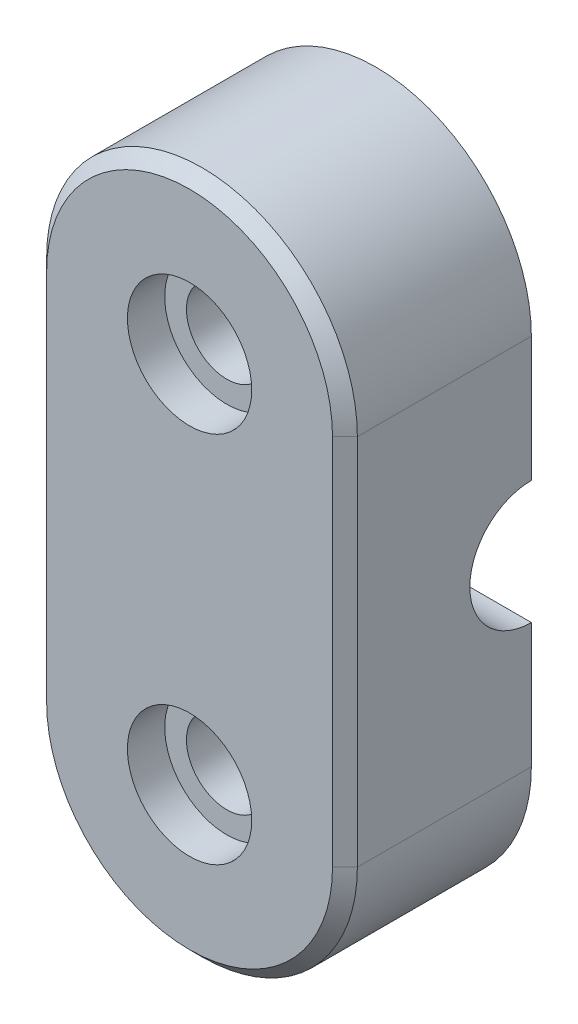
from build123d import *

# Parameters (mm, degrees)
SKETCH1_R           = 3.25
BOSS_EXTRUDE1_DEPTH = 15
CUT_EXTRUDE1_REACH  = 42.078
SKETCH2_R           = 4.95
CHAMFER1_SIZE       = 1
SKETCH3_R           = 5
CUT_EXTRUDE2_DEPTH  = 3


with BuildPart() as part:
    # Sketch1 → Boss-Extrude1 (new body)
    with BuildSketch(Plane.XY):
        with BuildLine():
            Line((-12.5, 15), (-12.5, -15))
            ThreePointArc((-12.5, -15), (0, -27.5), (12.5, -15))
            Line((12.5, -15), (12.5, 15))
            ThreePointArc((12.5, 15), (0, 27.5), (-12.5, 15))
        make_face()
        with Locations((0, 15)):
            Circle(SKETCH1_R, mode=Mode.SUBTRACT)
        with Locations((0, -15)):
            Circle(SKETCH1_R, mode=Mode.SUBTRACT)
    extrude(amount=BOSS_EXTRUDE1_DEPTH)

    # Sketch2 → Cut-Extrude1 (cut, up to next)
    with BuildSketch(Plane(origin=(12.5, 0, 0), x_dir=(0, 0, -1), z_dir=(1, 0, 0)), mode=Mode.PRIVATE) as cut_extrude1_sk1:
        Circle(SKETCH2_R)
    cut_extrude1_tool1 = extrude(cut_extrude1_sk1.sketch, amount=-CUT_EXTRUDE1_REACH, mode=Mode.PRIVATE) & part.part
    add(cut_extrude1_tool1.solids().sort_by_distance((12.5, 0, 0))[0], mode=Mode.SUBTRACT)

    # Chamfer1
    chamfer1_edges = [part.edges().sort_by_distance(p)[0] for p in [
        (-12.5, 0, 15),
        (0, -27.5, 15),
        (0, 27.5, 15),
        (12.5, 0, 15),
    ]]
    chamfer(chamfer1_edges, length=CHAMFER1_SIZE)

    # Sketch3 → Cut-Extrude2 (cut)
    with BuildSketch(Plane.XY.offset(15)):
        with Locations((0, 15)):
            Circle(SKETCH3_R)
        with Locations((0, -15)):
            Circle(SKETCH3_R)
    extrude(amount=-CUT_EXTRUDE2_DEPTH, mode=Mode.SUBTRACT)


solid = part.part
